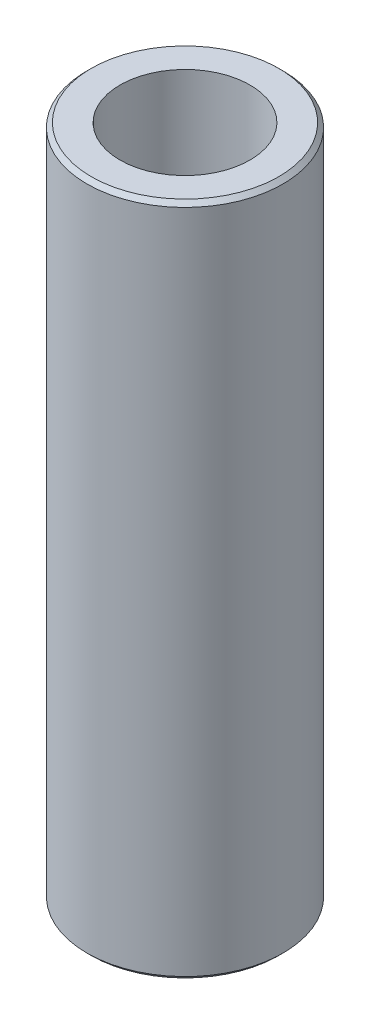
from build123d import *

# Parameters (mm, degrees)
SKETCH1_R           = 45
BOSS_EXTRUDE1_DEPTH = 309.64632088
SKETCH2_R           = 29.849076936
CUT_EXTRUDE1_DEPTH  = 317.118401923
CHAMFER1_SIZE       = 1.940583313


with BuildPart() as part:
    # Sketch1 → Boss-Extrude1 (new body)
    with BuildSketch(Plane(origin=(0, 0, 0), x_dir=(1, 0, 0), z_dir=(0, 1, 0))):
        Circle(SKETCH1_R)
    extrude(amount=BOSS_EXTRUDE1_DEPTH)

    # Sketch2 → Cut-Extrude1 (cut, through all)
    with BuildSketch(Plane(origin=(0, 0, 0), x_dir=(1, 0, 0), z_dir=(0, 1, 0))):
        Circle(SKETCH2_R)
    extrude(amount=CUT_EXTRUDE1_DEPTH, mode=Mode.SUBTRACT)

    # Chamfer1
    chamfer1_edges = [part.edges().sort_by_distance(p)[0] for p in [
        (-45, 309.64632088, 0),
        (-45, 0, 0),
    ]]
    chamfer(chamfer1_edges, length=CHAMFER1_SIZE)


solid = part.part
